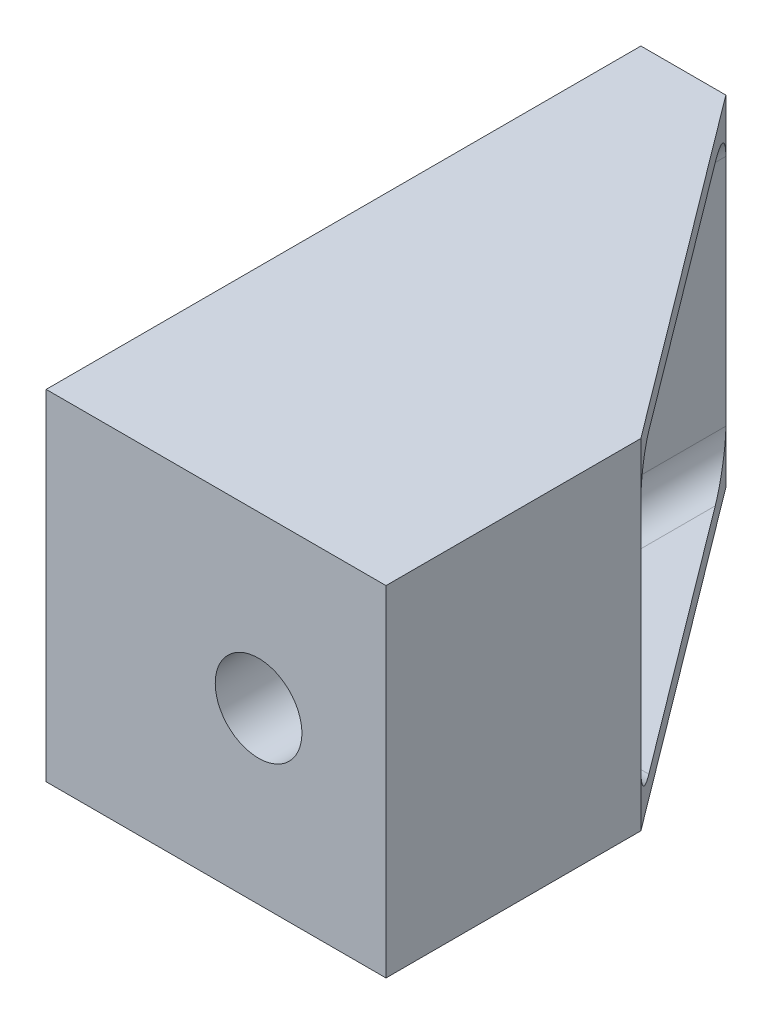
from build123d import *
from build123d.topology import SkipClean

# Parameters (mm, degrees)
SKETCH2_W           = 50.8
SKETCH2_H           = 50.8
SKETCH2_R           = 7.62
SKETCH2_R_2         = 2.4765
BOSS_EXTRUDE1_DEPTH = 6.35
SKETCH3_W           = 44.45
SKETCH3_H           = 50.8
SKETCH3_R           = 6.35
BOSS_EXTRUDE2_DEPTH = 12.7
SKETCH9_R           = 12.7
CUT_EXTRUDE2_DEPTH  = 10.16
RIB8_REACH          = 86.481
SKETCH13_WALL_W     = 234.462510634
SKETCH13_WALL_H     = 3.175
RIB9_REACH          = 86.481
SKETCH14_WALL_W     = 234.462510634
SKETCH14_WALL_H     = 3.175
BOSS_EXTRUDE5_REACH = 73.113
FILLET2_R           = 4.7625
SKETCH22_W          = 44.45
SKETCH22_H          = 50.8
BOSS_EXTRUDE6_DEPTH = 25.4
SKETCH20_R          = 6.477
CUT_EXTRUDE3_DEPTH  = 50.8
SKETCH23_R          = 19.177
CUT_EXTRUDE4_DEPTH  = 15.494
BOSS_EXTRUDE7_START = 6.35
SKETCH25_W          = 88.9
SKETCH25_H          = 50.8
SKETCH25_R          = 2.4765
SKETCH25_R_2        = 7.62
BOSS_EXTRUDE7_DEPTH = 6.35


with BuildPart() as part:
    # Sketch2 → Boss-Extrude1 (new body)
    with BuildSketch(Plane(origin=(0, 0, 0), x_dir=(0, 0, -1), z_dir=(1, 0, 0))):
        with Locations((25.4, 0)):
            Rectangle(SKETCH2_W, SKETCH2_H)
        with Locations((25.4, 0)):
            Circle(SKETCH2_R, mode=Mode.SUBTRACT)
        with Locations((32.732348419, 12.7)):
            Circle(SKETCH2_R_2, mode=Mode.SUBTRACT)
        with Locations((32.732348419, -12.7)):
            Circle(SKETCH2_R_2, mode=Mode.SUBTRACT)
        with Locations((10.735303163, 0)):
            Circle(SKETCH2_R_2, mode=Mode.SUBTRACT)
    extrude(amount=BOSS_EXTRUDE1_DEPTH)

    # Sketch3 → Boss-Extrude2 (add)
    with BuildSketch(Plane.XY):
        with Locations((22.225, 0)):
            Rectangle(SKETCH3_W, SKETCH3_H)
        with Locations((25.4, 0)):
            Circle(SKETCH3_R, mode=Mode.SUBTRACT)
    extrude(amount=BOSS_EXTRUDE2_DEPTH)

    # Sketch9 → Cut-Extrude2 (cut)
    with BuildSketch(Plane(origin=(0, 0, 0), x_dir=(-1, 0, 0), z_dir=(0, 0, -1))):
        with Locations((-25.4, 0)):
            Circle(SKETCH9_R)
    extrude(amount=-CUT_EXTRUDE2_DEPTH, mode=Mode.SUBTRACT)

    # Sketch13 wall → Rib8 (add, up to next)
    with BuildSketch(Plane(origin=(25.4, 25.4, -25.4), x_dir=(-0.6, 0, -0.8), z_dir=(-0.8, 0, 0.6)), mode=Mode.PRIVATE) as rib8_sk1:
        with Locations((0, 1.5875)):
            Rectangle(SKETCH13_WALL_W, SKETCH13_WALL_H)
    rib8_tool1 = extrude(rib8_sk1.sketch, amount=RIB8_REACH, mode=Mode.PRIVATE) - part.part
    add(rib8_tool1.solids().sort_by_distance((25.4, 25.4, -25.4))[0])

    # Sketch14 wall → Rib9 (add, up to next)
    with BuildSketch(Plane(origin=(25.4, -25.4, -25.4), x_dir=(-0.6, 0, -0.8), z_dir=(0.8, 0, -0.6)), mode=Mode.PRIVATE) as rib9_sk1:
        with Locations((0, 1.5875)):
            Rectangle(SKETCH14_WALL_W, SKETCH14_WALL_H)
    rib9_tool1 = extrude(rib9_sk1.sketch, amount=-RIB9_REACH, mode=Mode.PRIVATE) - part.part
    add(rib9_tool1.solids().sort_by_distance((25.4, -25.4, -25.4))[0])

    # Sketch17 → Boss-Extrude5 (add, up to next)
    with BuildSketch(Plane(origin=(1.058333333, 1.058333333, -1.058333333), x_dir=(0.8164965809277261, -0.408248290463863, 0.408248290463863), z_dir=(-0.5773502691896257, -0.5773502691896258, 0.5773502691896258)), mode=Mode.PRIVATE) as boss_extrude5_sk1:
        Polygon((6.480941611, -29.185832393), (6.480941611, -2.24506403), (29.812331411, -15.715448212), align=None)
    boss_extrude5_tool1 = extrude(boss_extrude5_sk1.sketch, amount=BOSS_EXTRUDE5_REACH, mode=Mode.PRIVATE) - part.part
    boss_extrude5 = boss_extrude5_tool1.solids().sort_by_distance((12.7, -15.875, -6.35))[0]
    add(boss_extrude5)

    # Mirror1: Boss-Extrude5 across plane
    add(boss_extrude5.mirror(Plane.ZX))

    # Fillet2
    fillet2_edges = [part.edges().sort_by_distance(p)[0] for p in [
        (34.925, 22.225, 0),
        (6.35, 22.225, -34.925),
        (6.35, -22.225, -34.925),
        (34.925, -22.225, 0),
        (6.35, 0, 0),
        (15.875, 22.225, -9.525),
        (15.875, 12.7, 0),
        (6.35, 12.7, -9.525),
        (6.35, -12.7, -9.525),
        (15.875, -22.225, -9.525),
        (15.875, -12.7, 0),
    ]]
    fillet(fillet2_edges, radius=FILLET2_R)

    # Sketch22 → Boss-Extrude6 (add)
    with BuildSketch(Plane.XY.offset(12.7)):
        with Locations((22.225, 0)):
            Rectangle(SKETCH22_W, SKETCH22_H)
    extrude(amount=BOSS_EXTRUDE6_DEPTH)

    # Sketch20 → Cut-Extrude3 (cut)
    with BuildSketch(Plane.XY.offset(12.7)):
        with Locations((25.4, 0)):
            Circle(SKETCH20_R)
    extrude(amount=CUT_EXTRUDE3_DEPTH, mode=Mode.SUBTRACT)

    # Sketch23 → Cut-Extrude4 (cut)
    with BuildSketch(Plane(origin=(6.35, 0, 0), x_dir=(0, 0, -1), z_dir=(1, 0, 0))):
        with Locations((25.4, 0)):
            Circle(SKETCH23_R)
    extrude(amount=CUT_EXTRUDE4_DEPTH, mode=Mode.SUBTRACT)

    # Sketch25 → Boss-Extrude7 (add)
    with SkipClean():  # the faces are left unmerged after this step: merging them gives an invalid solid
        with BuildSketch(Plane.ZY.offset(BOSS_EXTRUDE7_START)):
            with Locations((-6.35, 0)):
                Rectangle(SKETCH25_W, SKETCH25_H)
            with Locations((-32.732348419, -12.7)):
                Circle(SKETCH25_R, mode=Mode.SUBTRACT)
            with Locations((-10.735303163, 0)):
                Circle(SKETCH25_R, mode=Mode.SUBTRACT)
            with Locations((-32.732348419, 12.7)):
                Circle(SKETCH25_R, mode=Mode.SUBTRACT)
            with Locations((-25.4, 0)):
                Circle(SKETCH25_R_2, mode=Mode.SUBTRACT)
        extrude(amount=-BOSS_EXTRUDE7_DEPTH)


solid = part.part
